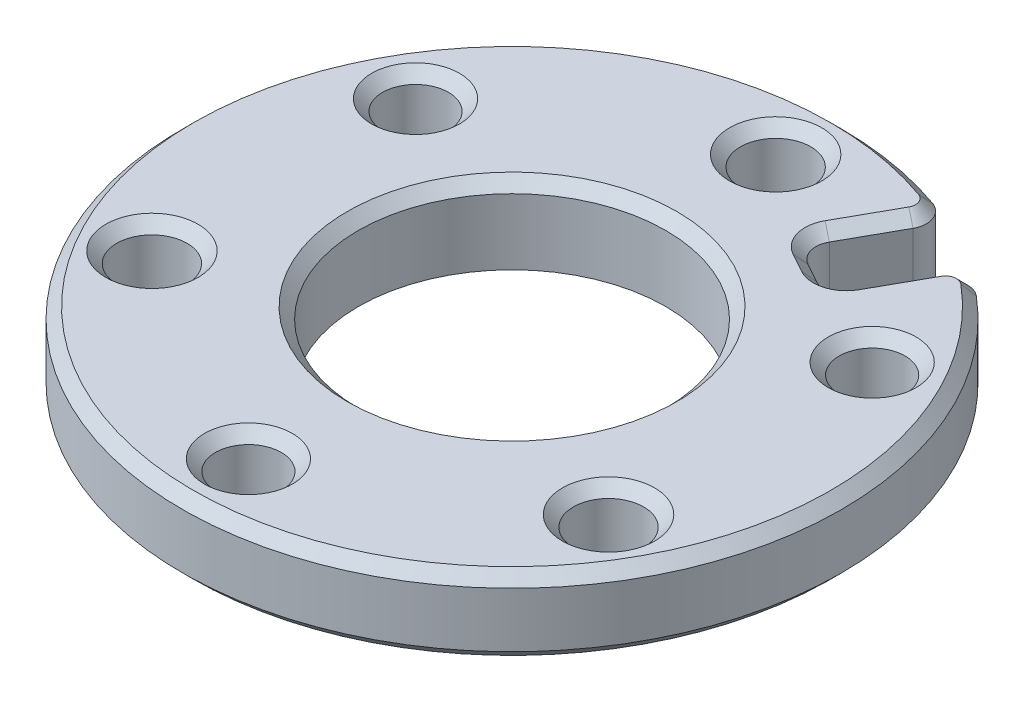
from build123d import *

# Parameters (mm, degrees)
SKETCH_1_R          = 15
SKETCH_1_R_2        = 1.6
SKETCH_1_R_3        = 1.5
SKETCH_1_R_4        = 7
EXTRUDE_1_DEPTH     = 3.5
CUT_EXTRUDE_1_DEPTH = 8
FILLET_1_R          = 1
FILLET_2_R          = 1
CHAMFER_1_SIZE      = 0.5


with BuildPart() as part:
    # 草图1 → 凸台-拉伸1 (new body)
    with BuildSketch(Plane(origin=(0, 0, 0), x_dir=(1, 0, 0), z_dir=(0, 1, 0))):
        Circle(SKETCH_1_R)
        with Locations((0, 12)):
            Circle(SKETCH_1_R_2, mode=Mode.SUBTRACT)
        with Locations((10.392304845, -6)):
            Circle(SKETCH_1_R_2, mode=Mode.SUBTRACT)
        with Locations((-10.392304845, -6)):
            Circle(SKETCH_1_R_2, mode=Mode.SUBTRACT)
        with Locations((10.392304845, 6)):
            Circle(SKETCH_1_R_3, mode=Mode.SUBTRACT)
        with Locations((0, -12)):
            Circle(SKETCH_1_R_3, mode=Mode.SUBTRACT)
        with Locations((-10.392304845, 6)):
            Circle(SKETCH_1_R_3, mode=Mode.SUBTRACT)
        Circle(SKETCH_1_R_4, mode=Mode.SUBTRACT)
    extrude(amount=EXTRUDE_1_DEPTH)

    # 草图2 → 切除-拉伸1 (cut)
    with BuildSketch(Plane(origin=(0, 3.5, 0), x_dir=(1, 0, 0), z_dir=(0, 1, 0))):
        Polygon((3.690349309, 9.391530065), (6.310792277, 7.930955296), (9.125758213, 12.981335358), (6.505315246, 14.441910127), align=None)
    extrude(amount=-CUT_EXTRUDE_1_DEPTH, mode=Mode.SUBTRACT)

    # 圆角1
    fillet_1_edges = [part.edges().sort_by_distance(p)[0] for p in [
        (8.700707091, 1.75, -12.218743639),
        (6.095052455, 1.75, -13.705850414),
    ]]
    fillet(fillet_1_edges, radius=FILLET_1_R)

    # 圆角2
    fillet_2_edges = [part.edges().sort_by_distance(p)[0] for p in [
        (6.310792277, 1.75, -7.930955296),
        (3.690349309, 1.75, -9.391530065),
    ]]
    fillet(fillet_2_edges, radius=FILLET_2_R)

    # 倒角1
    chamfer_1_edges = [part.edges().sort_by_distance(p)[0] for p in [
        (5.000570793, 0, -8.661242681),
        (4.08878345, 0, -9.504769242),
        (6.1975531, 0, -8.329389436),
        (4.859185687, 0, -11.488560036),
        (7.466276221, 0, -10.004029432),
        (5.603157458, 0, -13.552361106),
        (8.827728967, 0, -11.700311046),
        (-7.446160806, 0, 13.021316725),
        (5.000570793, 3.5, -8.661242681),
        (4.08878345, 3.5, -9.504769242),
        (6.1975531, 3.5, -8.329389436),
        (4.859185687, 3.5, -11.488560036),
        (7.466276221, 3.5, -10.004029432),
        (5.603157458, 3.5, -13.552361106),
        (8.827728967, 3.5, -11.700311046),
        (-7.446160806, 3.5, 13.021316725),
        (-11.992304845, 0, 6),
        (-1.5, 0, 12),
        (8.792304845, 0, 6),
        (8.892304845, 0, -6),
        (-1.6, 0, -12),
        (-11.892304845, 0, -6),
        (-1.6, 3.5, -12),
        (8.892304845, 3.5, -6),
        (8.792304845, 3.5, 6),
        (-1.5, 3.5, 12),
        (-11.992304845, 3.5, 6),
        (-11.892304845, 3.5, -6),
        (-7, 3.5, 0),
    ]]
    chamfer(chamfer_1_edges, length=CHAMFER_1_SIZE)


solid = part.part
